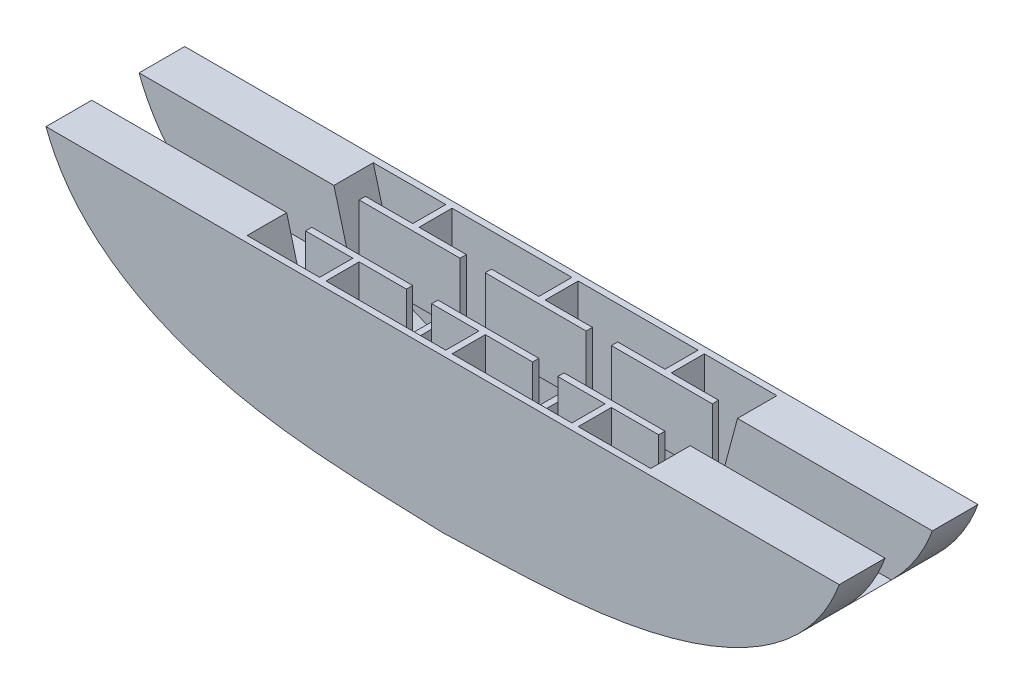
from build123d import *

# Parameters (mm, degrees)
BOSS_EXTRUDE1_DEPTH                 = 111.76
SKETCH5_W                           = 304.8
SKETCH5_H                           = 25.4
CUT_EXTRUDE3_DEPTH                  = 101.6
CUT_EXTRUDE4_DEPTH                  = 227.288199427
CUT_EXTRUDE4_DEPTH_BACK             = 227.288199427
SKETCH3_W                           = 96.52
SKETCH3_H                           = 101.6
SKETCH3_W_2                         = 48.26
CUT_EXTRUDE5_REACH                  = 288.663
SKETCH6_W                           = 38.1
SKETCH6_H                           = 50.8
SKETCH7_W                           = 81.28
SKETCH7_H                           = 50.8
BOSS_EXTRUDE2_DEPTH                 = 5.08
SKETCH9_W                           = 5.08
SKETCH9_H                           = 95.25
BOSS_EXTRUDE3_DEPTH                 = 10.16
SKETCH10_W                          = 5.08
SKETCH10_H                          = 95.206439839
BOSS_EXTRUDE4_DEPTH                 = 10.16
CUT_EXTRUDE7_REACH                  = 208.854
FILLET1_R                           = 50.8
BOSS_EXTRUDE5_REACH                 = 208.854
CUT_EXTRUDE8_REACH                  = 248.593
CUT_EXTRUDE8_END_RADIUS             = 126.32098656
CUT_EXTRUDE8_DIRECTION_2_REACH      = 248.593
CUT_EXTRUDE8_DIRECTION_2_END_RADIUS = 126.32098656
BOSS_EXTRUDE6_REACH                 = 248.593
CUT_EXTRUDE9_DEPTH                  = 241.3
CUT_EXTRUDE9_DEPTH_BACK             = 241.3
CUT_EXTRUDE10_REACH                 = 346.185
SKETCH16_W                          = 38.1
SKETCH16_H                          = 50.8
CUT_EXTRUDE10_DIRECTION_2_REACH     = 346.185


with BuildPart() as part:
    # Sketch1 → Boss-Extrude1 (new body)
    with BuildSketch(Plane.XY):
        Polygon((-152.4, 62.23), (-152.4, -33.02), (0, -62.23), (152.4, -32.976439839), (152.4, 62.23), align=None)
    extrude(amount=-BOSS_EXTRUDE1_DEPTH)

    # Sketch5 → Cut-Extrude3 (cut)
    with BuildSketch(Plane.XY.offset(-5.08)):
        with Locations((0, -1.27)):
            Rectangle(SKETCH5_W, SKETCH5_H)
    extrude(amount=-CUT_EXTRUDE3_DEPTH, mode=Mode.SUBTRACT)

    # Sketch3 → Cut-Extrude4 (cut, two sides: drawn at the far end of the back side and taken through both)
    with BuildSketch(Plane(origin=(0, 62.23, 0), x_dir=(1, 0, 0), z_dir=(0, 1, 0)).offset(-CUT_EXTRUDE4_DEPTH_BACK)):
        with Locations((-50.8, 55.88)):
            Rectangle(SKETCH3_W, SKETCH3_H)
        with Locations((50.8, 55.88)):
            Rectangle(SKETCH3_W, SKETCH3_H)
        with Locations((-128.27, 55.88)):
            Rectangle(SKETCH3_W_2, SKETCH3_H)
        with Locations((128.27, 55.88)):
            Rectangle(SKETCH3_W_2, SKETCH3_H)
    extrude(amount=CUT_EXTRUDE4_DEPTH + CUT_EXTRUDE4_DEPTH_BACK, mode=Mode.SUBTRACT)

    # Cut-Extrude5: up to this face of the body (flat: up to its plane)
    cut_extrude5_end = Plane(part.part.faces().sort_by_distance((104.14, 36.83, -55.88))[0])
    # Sketch6 → Cut-Extrude5 (cut, up to the picked face)
    with BuildSketch(Plane.ZY.offset(104.14), mode=Mode.PRIVATE) as cut_extrude5_sk1:
        with Locations((-55.932057734, 36.83)):
            Rectangle(SKETCH6_W, SKETCH6_H)
    cut_extrude5_tool1 = split(extrude(cut_extrude5_sk1.sketch, amount=-CUT_EXTRUDE5_REACH, mode=Mode.PRIVATE), bisect_by=cut_extrude5_end, keep=Keep.BOTH, mode=Mode.PRIVATE)
    add(cut_extrude5_tool1.solids().sort_by(Axis((-104.14, 36.83, -55.932058), (1, 0, 0)))[0], mode=Mode.SUBTRACT)

    # Sketch7 → Boss-Extrude2 (add)
    with BuildSketch(Plane(origin=(0, 0, -36.882057734), x_dir=(-1, 0, 0), z_dir=(0, 0, -1))):
        with Locations((0, 36.83)):
            Rectangle(SKETCH7_W, SKETCH7_H)
        with Locations((101.6, 36.83)):
            Rectangle(SKETCH7_W, SKETCH7_H)
        with Locations((-101.6, 36.83)):
            Rectangle(SKETCH7_W, SKETCH7_H)
    boss_extrude2 = extrude(amount=-BOSS_EXTRUDE2_DEPTH)

    # Mirror1: Boss-Extrude2 across plane
    add(boss_extrude2.mirror(Plane(origin=(0, 0, -55.932057734), x_dir=(1, 0, 0), z_dir=(0, 0, -1))))

    # Sketch9 → Boss-Extrude3 (add)
    with BuildSketch(Plane.ZY.offset(152.4)):
        with Locations((-109.22, 14.605)):
            Rectangle(SKETCH9_W, SKETCH9_H)
        with Locations((-2.54, 14.605)):
            Rectangle(SKETCH9_W, SKETCH9_H)
    extrude(amount=BOSS_EXTRUDE3_DEPTH)

    # Sketch10 → Boss-Extrude4 (add)
    with BuildSketch(Plane(origin=(152.4, 0, 0), x_dir=(0, 0, -1), z_dir=(1, 0, 0))):
        with Locations((2.54, 14.626780081)):
            Rectangle(SKETCH10_W, SKETCH10_H)
        with Locations((109.22, 14.626780081)):
            Rectangle(SKETCH10_W, SKETCH10_H)
    extrude(amount=BOSS_EXTRUDE4_DEPTH)

    # Cut-Extrude7: up to this face of the body (flat: up to its plane)
    cut_extrude7_end = Plane(part.part.faces().sort_by_distance((-0.011490312, 7.400814094, -111.76))[0])
    # Sketch11 → Cut-Extrude7 (cut, up to the picked face)
    with BuildSketch(Plane.XY, mode=Mode.PRIVATE) as cut_extrude7_sk1:
        Polygon((-162.56, -12.7), (-119.696308585, -39.288207521), (-152.4, -33.02), (-162.56, -33.02), align=None)
    cut_extrude7_tool1 = split(extrude(cut_extrude7_sk1.sketch, amount=-CUT_EXTRUDE7_REACH, mode=Mode.PRIVATE), bisect_by=cut_extrude7_end, keep=Keep.BOTH, mode=Mode.PRIVATE)
    # Sketch11 → Cut-Extrude7 (cut, up to the picked face)
    with BuildSketch(Plane.XY, mode=Mode.PRIVATE) as cut_extrude7_sk2:
        Polygon((152.4, -33.02), (162.56, -33.02), (162.56, -12.7), (119.696308585, -39.288207521), align=None)
    cut_extrude7_tool2 = split(extrude(cut_extrude7_sk2.sketch, amount=-CUT_EXTRUDE7_REACH, mode=Mode.PRIVATE), bisect_by=cut_extrude7_end, keep=Keep.BOTH, mode=Mode.PRIVATE)
    add(cut_extrude7_tool1.solids().sort_by(Axis((-148.539263, -27.801749, 0), (0, 0, -1)))[0], mode=Mode.SUBTRACT)
    add(cut_extrude7_tool2.solids().sort_by(Axis((148.539263, -27.801749, 0), (0, 0, -1)))[0], mode=Mode.SUBTRACT)

    # Fillet1
    # the kernel refuses this fillet: 50.8 mm, written as the material it takes off along each edge
    with BuildSketch(Plane(origin=(-162.56, -12.7, 70.671047804), x_dir=(0.8497897447130388, -0.5271217978613181, 0), z_dir=(0, 0, -1)), Plane(origin=(-162.56, -12.7, -36.008952196), x_dir=(0.8497897447130388, -0.5271217978613181, 0), z_dir=(0, 0, -1)), Plane(origin=(162.56, -12.7, 70.671047804), x_dir=(0, 1, 0), z_dir=(0, 0, -1))) as fillet1_piece_1:
        with BuildLine():
            CenterArc((FILLET1_R * 0.556464943335, -FILLET1_R), FILLET1_R, 90, 58.188808221)
            Line((-FILLET1_R * 0.293324801378, -FILLET1_R * 0.472878202139), (0, 0))
            Line((0, 0), (FILLET1_R * 0.556464943335, 0))
        make_face()
    extrude(amount=146.422095607, mode=Mode.SUBTRACT)
    with BuildSketch(Plane(origin=(-119.696308585, -39.288207521, -83.186546401), x_dir=(0.9821230119270369, -0.18824024395268216, 0), z_dir=(0, 0, -1)), Plane(origin=(-119.696308585, -39.288207521, 23.493453599), x_dir=(0.9821230119270369, -0.18824024395268216, 0), z_dir=(0, 0, -1))) as fillet1_piece_2:
        with BuildLine():
            CenterArc((FILLET1_R * 0.184987823618, -FILLET1_R), FILLET1_R, 90, 20.961087149)
            Line((-FILLET1_R * 0.172745995297, -FILLET1_R * 0.0661764005955), (0, 0))
            Line((0, 0), (FILLET1_R * 0.184987823618, 0))
        make_face()
    extrude(amount=52.066907199, mode=Mode.SUBTRACT)
    with BuildSketch(Plane(origin=(162.56, -12.7, -36.008952196), x_dir=(-0.8497897447130388, -0.5271217978613181, 0), z_dir=(0, 0, -1))) as fillet1_piece_3:
        with BuildLine():
            CenterArc((FILLET1_R * 0.556464943335, FILLET1_R), FILLET1_R, 211.811191779, 58.188808221)
            Line((-FILLET1_R * 0.293324801378, FILLET1_R * 0.472878202139), (0, 0))
            Line((0, 0), (FILLET1_R * 0.556464943335, 0))
        make_face()
    extrude(amount=146.422095607, mode=Mode.SUBTRACT)
    with BuildSketch(Plane(origin=(119.776180176, -39.238663434, -83.204651008), x_dir=(-0.9820710795721669, -0.18851099349363817, 0), z_dir=(0, 0, -1)), Plane(origin=(119.776180176, -39.238663434, 23.475348992), x_dir=(-0.9820710795721669, -0.18851099349363817, 0), z_dir=(0, 0, -1))) as fillet1_piece_4:
        with BuildLine():
            CenterArc((FILLET1_R * 0.184845267653, FILLET1_R), FILLET1_R, 249.054708445, 20.945291555)
            Line((-FILLET1_R * 0.172631096402, FILLET1_R * 0.0660778141933), (0, 0))
            Line((0, 0), (FILLET1_R * 0.184845267653, 0))
        make_face()
    extrude(amount=52.030697984, mode=Mode.SUBTRACT)
    with BuildSketch(Plane(origin=(0, -62.23, 24.359816254), x_dir=(-0.982123011927037, 0.1882402439526816, 0), z_dir=(0, 0, -1))) as fillet1_piece_5:
        with BuildLine():
            CenterArc((FILLET1_R * 0.191809576801, FILLET1_R), FILLET1_R, 248.283995147, 21.716004853)
            Line((-FILLET1_R * 0.178196707507, FILLET1_R * 0.0709707488072), (0, 0))
            Line((0, 0), (FILLET1_R * 0.191809576801, 0))
        make_face()
    extrude(amount=160.479632508, mode=Mode.SUBTRACT)

    # Boss-Extrude5: up to this face of the body (flat: up to its plane)
    boss_extrude5_end = Plane(part.part.faces().sort_by_distance((-0.004732582, 8.379000895, -111.76))[0])
    # Sketch12 → Boss-Extrude5 (add, up to the picked face)
    with BuildSketch(Plane.XY, mode=Mode.PRIVATE) as boss_extrude5_sk1:
        with BuildLine():
            Line((-162.56, 62.23), (-210.82, 62.23))
            ThreePointArc((-210.82, 62.23), (-185.525923559, 8.586514121), (-138.537787331, -27.60089991))
            Line((-138.537787331, -27.60089991), (-162.56, 62.23))
        make_face()
    boss_extrude5_tool1 = split(extrude(boss_extrude5_sk1.sketch, amount=-BOSS_EXTRUDE5_REACH, mode=Mode.PRIVATE), bisect_by=boss_extrude5_end, keep=Keep.BOTH, mode=Mode.PRIVATE)
    # Sketch12 → Boss-Extrude5 (add, up to the picked face)
    with BuildSketch(Plane.XY, mode=Mode.PRIVATE) as boss_extrude5_sk2:
        with BuildLine():
            Line((162.56, 62.23), (210.82, 62.23))
            ThreePointArc((210.82, 62.23), (185.525923559, 8.586514121), (138.537787331, -27.60089991))
            Line((138.537787331, -27.60089991), (162.56, 62.23))
        make_face()
    boss_extrude5_tool2 = split(extrude(boss_extrude5_sk2.sketch, amount=-BOSS_EXTRUDE5_REACH, mode=Mode.PRIVATE), bisect_by=boss_extrude5_end, keep=Keep.BOTH, mode=Mode.PRIVATE)
    add(boss_extrude5_tool1.solids().sort_by(Axis((-173.436994, 26.131053, 0), (0, 0, -1)))[0])
    add(boss_extrude5_tool2.solids().sort_by(Axis((173.436994, 26.131053, 0), (0, 0, -1)))[0])

    # Cut-Extrude8: up to this cylinder (the profile starts inside it)
    cut_extrude8_end = Plane(origin=(-87.109319049, 87.777192878, -55.90231), z_dir=(0, 0, 1)) * Cylinder(CUT_EXTRUDE8_END_RADIUS, 750.827973119, mode=Mode.PRIVATE)
    # Sketch13 → Cut-Extrude8 (cut, up to the surface)
    with BuildSketch(Plane(origin=(0, 0, 0), x_dir=(0, 0, -1), z_dir=(1, 0, 0)), mode=Mode.PRIVATE) as cut_extrude8_sk1:
        Polygon((36.882057734, 62.23), (36.882057734, 11.43), (5.08, 11.43), (5.08, -13.97), (106.68, -13.97), (106.68, 11.43), (74.982057734, 11.43), (74.982057734, 62.23), align=None)
    cut_extrude8_tool1 = extrude(cut_extrude8_sk1.sketch, amount=-CUT_EXTRUDE8_REACH, mode=Mode.PRIVATE) & cut_extrude8_end
    add(cut_extrude8_tool1.solids().sort_by_distance((0, 15.058571, -55.90231))[0], mode=Mode.SUBTRACT)

    # Cut-Extrude8 direction 2: up to this cylinder (the profile starts inside it)
    cut_extrude8_direction_2_end = Plane(origin=(87.109319049, 87.777192878, -55.90231), z_dir=(0, 0, 1)) * Cylinder(CUT_EXTRUDE8_DIRECTION_2_END_RADIUS, 750.827973119, mode=Mode.PRIVATE)
    # Sketch13 → Cut-Extrude8 direction 2 (cut, up to the surface)
    with BuildSketch(Plane(origin=(0, 0, 0), x_dir=(0, 0, -1), z_dir=(1, 0, 0)), mode=Mode.PRIVATE) as cut_extrude8_direction_2_sk1:
        Polygon((36.882057734, 62.23), (36.882057734, 11.43), (5.08, 11.43), (5.08, -13.97), (106.68, -13.97), (106.68, 11.43), (74.982057734, 11.43), (74.982057734, 62.23), align=None)
    cut_extrude8_direction_2_tool1 = extrude(cut_extrude8_direction_2_sk1.sketch, amount=CUT_EXTRUDE8_DIRECTION_2_REACH, mode=Mode.PRIVATE) & cut_extrude8_direction_2_end
    add(cut_extrude8_direction_2_tool1.solids().sort_by_distance((0, 15.058571, -55.90231))[0], mode=Mode.SUBTRACT)

    # Boss-Extrude6: up to this face of the body (flat: up to its plane)
    boss_extrude6_end = Plane(part.part.faces().sort_by_distance((-0.004136206, 11.247831231, 0))[0])
    # Sketch14 → Boss-Extrude6 (add, up to the picked face)
    with BuildSketch(Plane(origin=(0, 0, -111.76), x_dir=(-1, 0, 0), z_dir=(0, 0, -1)), mode=Mode.PRIVATE) as boss_extrude6_sk1:
        with BuildLine():
            Line((-204.363754457, 62.23), (-319.532, 62.23))
            add(Edge.make_bspline(
                [(0.000127649, -61.30395141), (-63.035732171, -58.729844517), (-184.13294652, -59.341328161), (-298.396851531, 4.939109547), (-319.532, 62.23)],
                knots=[0, 0, 0, 0, 0.522454117, 1, 1, 1, 1], degree=3))
            Line((0.000127649, -61.30395141), (0.000127649, -56.388))
            add(Edge.make_bspline(
                [(0.000127649, -56.388), (-34.292089751, -49.634065585), (-117.293617019, -40.449633361), (-194.674150599, 7.604249577), (-204.363754457, 62.23)],
                knots=[0, 0, 0, 0, 0.415909415, 1, 1, 1, 1], degree=3))
        make_face()
    boss_extrude6_tool1 = split(extrude(boss_extrude6_sk1.sketch, amount=-BOSS_EXTRUDE6_REACH, mode=Mode.PRIVATE), bisect_by=boss_extrude6_end, keep=Keep.BOTH, mode=Mode.PRIVATE)
    # Sketch14 → Boss-Extrude6 (add, up to the picked face)
    with BuildSketch(Plane(origin=(0, 0, -111.76), x_dir=(-1, 0, 0), z_dir=(0, 0, -1)), mode=Mode.PRIVATE) as boss_extrude6_sk2:
        with BuildLine():
            Line((0.000127649, -56.388), (0.000127649, -61.30395141))
            add(Edge.make_bspline(
                [(0.000127649, -61.30395141), (63.035732171, -58.729844517), (184.13294652, -59.341328161), (298.396851531, 4.939109547), (319.532, 62.23)],
                knots=[0, 0, 0, 0, 0.522454117, 1, 1, 1, 1], degree=3))
            Line((319.532, 62.23), (204.363754457, 62.23))
            add(Edge.make_bspline(
                [(0.000127649, -56.388), (34.292089751, -49.634065585), (117.293617019, -40.449633361), (194.674150599, 7.604249577), (204.363754457, 62.23)],
                knots=[0, 0, 0, 0, 0.415909415, 1, 1, 1, 1], degree=3))
        make_face()
    boss_extrude6_tool2 = split(extrude(boss_extrude6_sk2.sketch, amount=-BOSS_EXTRUDE6_REACH, mode=Mode.PRIVATE), bisect_by=boss_extrude6_end, keep=Keep.BOTH, mode=Mode.PRIVATE)
    add(boss_extrude6_tool1.solids().sort_by(Axis((202.795825, 2.026931, -111.76), (0, 0, 1)))[0])
    add(boss_extrude6_tool2.solids().sort_by(Axis((-202.795984, 2.026638, -111.76), (0, 0, 1)))[0])

    # Sketch15 → Cut-Extrude9 (cut, two sides: drawn at the far end of the back side and taken through both)
    with BuildSketch(Plane(origin=(0, 0, 0), x_dir=(0, 0, -1), z_dir=(1, 0, 0)).offset(-CUT_EXTRUDE9_DEPTH_BACK)):
        Polygon((36.882057734, 62.23), (36.882057734, 11.43), (5.08, 11.43), (5.08, -13.97), (106.68, -13.97), (106.68, 11.43), (74.982057734, 11.43), (74.982057734, 62.23), align=None)
    extrude(amount=CUT_EXTRUDE9_DEPTH + CUT_EXTRUDE9_DEPTH_BACK, mode=Mode.SUBTRACT)

    # Sketch16 → Cut-Extrude10 (cut, up to next)
    with BuildSketch(Plane(origin=(0, 0, 0), x_dir=(0, 0, -1), z_dir=(1, 0, 0)), mode=Mode.PRIVATE) as cut_extrude10_sk1:
        with Locations((55.932057734, 36.83)):
            Rectangle(SKETCH16_W, SKETCH16_H)
    cut_extrude10_tool1 = extrude(cut_extrude10_sk1.sketch, amount=-CUT_EXTRUDE10_REACH, mode=Mode.PRIVATE) & part.part
    add(cut_extrude10_tool1.solids().sort_by_distance((0, 36.83, -55.932058))[0], mode=Mode.SUBTRACT)

    # Sketch16 → Cut-Extrude10 direction 2 (cut, up to next)
    with BuildSketch(Plane(origin=(0, 0, 0), x_dir=(0, 0, -1), z_dir=(1, 0, 0)), mode=Mode.PRIVATE) as cut_extrude10_direction_2_sk1:
        with Locations((55.932057734, 36.83)):
            Rectangle(SKETCH16_W, SKETCH16_H)
    cut_extrude10_direction_2_tool1 = extrude(cut_extrude10_direction_2_sk1.sketch, amount=CUT_EXTRUDE10_DIRECTION_2_REACH, mode=Mode.PRIVATE) & part.part
    add(cut_extrude10_direction_2_tool1.solids().sort_by_distance((0, 36.83, -55.932058))[0], mode=Mode.SUBTRACT)


solid = part.part
